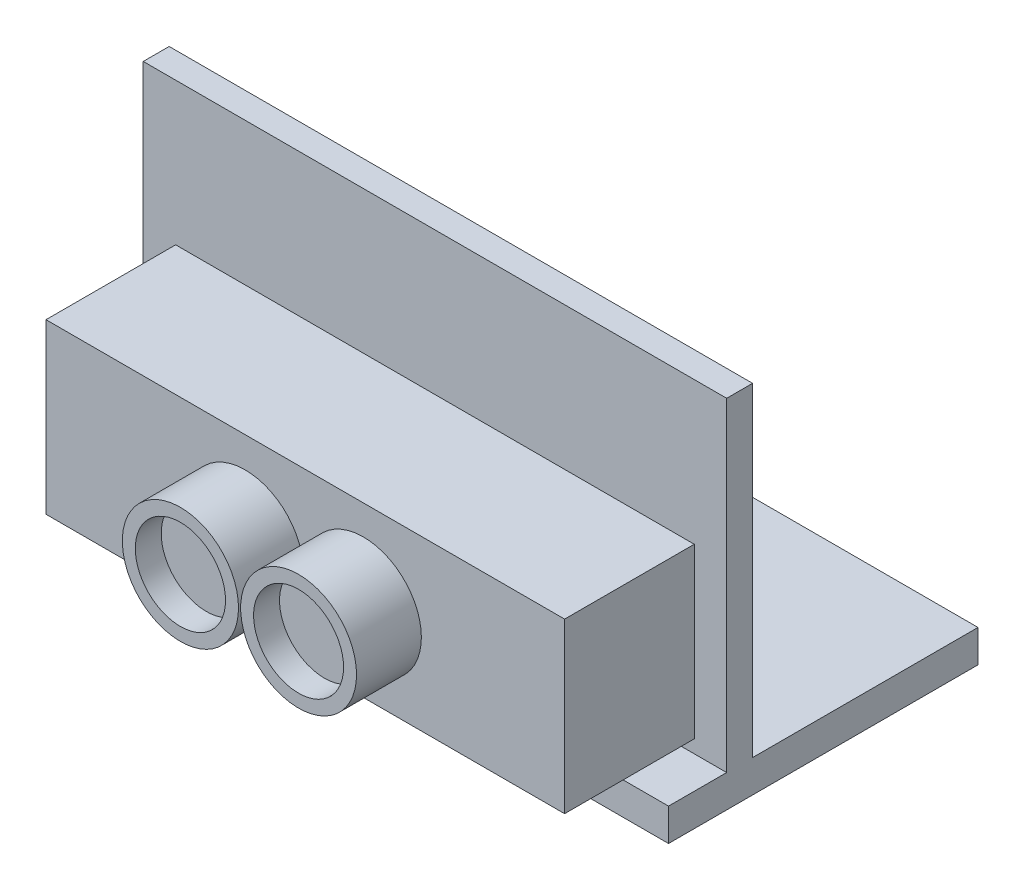
from build123d import *

# Parameters (mm, degrees)
SKETCH1_W            = 45
SKETCH1_H            = 25
BOSS_EXTRUDE1_DEPTH  = 2
SKETCH2_W            = 40
SKETCH2_H            = 13
BOSS_EXTRUDE2_DEPTH  = 10
SKETCH9_R            = 4.469817206
SKETCH9_R_2          = 4.480165914
BOSS_EXTRUDE8_DEPTH  = 5
SKETCH10_R           = 3.469817206
SKETCH10_R_2         = 3.480165914
CUT_EXTRUDE5_DEPTH   = 2
SKETCH12_W           = 45
SKETCH12_H           = 23.870594052
BOSS_EXTRUDE11_DEPTH = 2.5
SKETCH13_R           = 1.5
CUT_EXTRUDE6_DEPTH   = 2.5


with BuildPart() as part:
    # Sketch1 → Boss-Extrude1 (new body)
    with BuildSketch(Plane.XY):
        Rectangle(SKETCH1_W, SKETCH1_H)
    extrude(amount=BOSS_EXTRUDE1_DEPTH)

    # Sketch2 → Boss-Extrude2 (add)
    with BuildSketch(Plane.XY.offset(2)):
        with Locations((0, -5)):
            Rectangle(SKETCH2_W, SKETCH2_H)
    extrude(amount=BOSS_EXTRUDE2_DEPTH)

    # Sketch9 → Boss-Extrude8 (add)
    with BuildSketch(Plane.XY.offset(12)):
        with Locations((4.481856026, -5.240684726)):
            Circle(SKETCH9_R)
        with Locations((-4.632994446, -5.330904687)):
            Circle(SKETCH9_R_2)
    extrude(amount=BOSS_EXTRUDE8_DEPTH)

    # Sketch10 → Cut-Extrude5 (cut)
    with BuildSketch(Plane.XY.offset(17)):
        with Locations((4.481856026, -5.240684726)):
            Circle(SKETCH10_R)
        with Locations((-4.632994446, -5.330904687)):
            Circle(SKETCH10_R_2)
    extrude(amount=-CUT_EXTRUDE5_DEPTH, mode=Mode.SUBTRACT)

    # Sketch12 → Boss-Extrude11 (add)
    with BuildSketch(Plane.XZ.offset(12.5)):
        with Locations((0, -5.450175017)):
            Rectangle(SKETCH12_W, SKETCH12_H)
    extrude(amount=BOSS_EXTRUDE11_DEPTH)

    # Sketch13 → Cut-Extrude6 (cut)
    with BuildSketch(Plane(origin=(0, -12.5, 0), x_dir=(1, 0, 0), z_dir=(0, 1, 0))):
        with Locations((-0.152828532, 13.748145858)):
            Circle(SKETCH13_R)
    extrude(amount=-CUT_EXTRUDE6_DEPTH, mode=Mode.SUBTRACT)


solid = part.part
